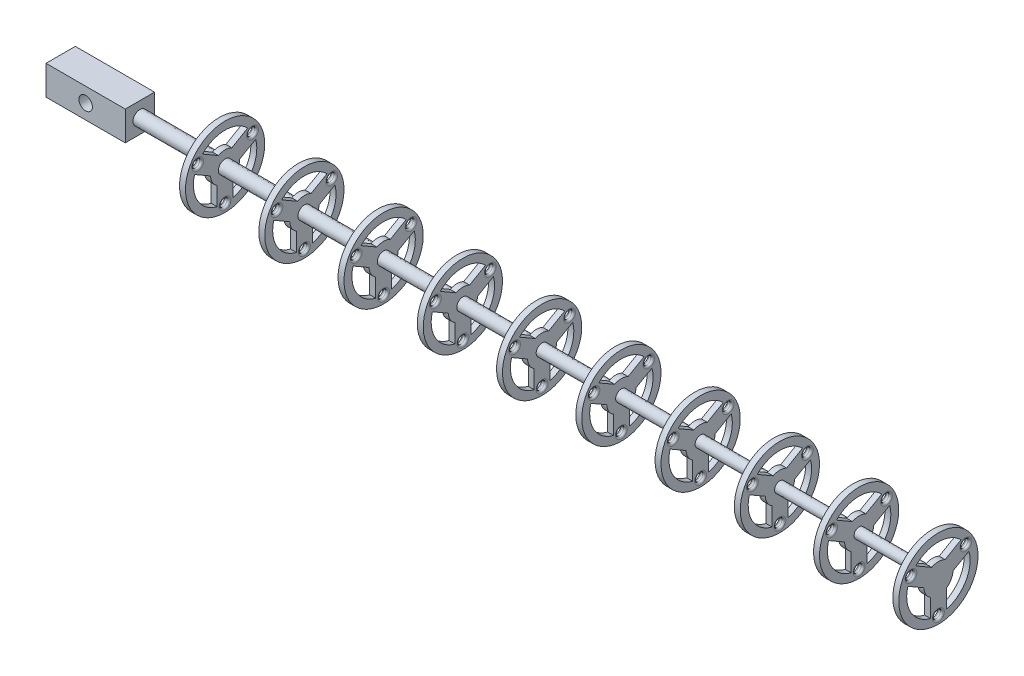
from build123d import *

# Parameters (mm, degrees)
SKETCH3_W                      = 1.5
SKETCH3_H                      = 10
CUT_EXTRUDE1_REACH             = 181.059
SKETCH5_R                      = 1
FILLET1_R                      = 0.5
LPATTERN1_COUNT                = 10
LPATTERN1_PITCH                = 20
FILLET1_OF_LPATTERN1_R         = 0.5
SKETCH16_W                     = 7.4
SKETCH16_H                     = 7.4
BOSS_EXTRUDE1_DEPTH            = 20
M3_CLEARANCE_HOLE1_D           = 3.4
M3_CLEARANCE_HOLE1_CSINK_D     = 3.45
M3_CLEARANCE_HOLE1_CSINK_ANGLE = 90


with BuildPart() as part:
    # Sketch2 → Revolve1 (revolve)
    with BuildSketch(Plane.XY):
        Polygon((0, 1.75), (200, 1.25), (200, 0), (0, 0), align=None)
    revolve(axis=Axis((200, 0, 0), (-1, 0, 0)))

    # Sketch3 → Revolve2 (revolve)
    with BuildSketch(Plane.XY):
        with Locations((20.75, 5)):
            Rectangle(SKETCH3_W, SKETCH3_H)
    revolve2 = revolve(axis=Axis((21.5, 0, 0), (-1, 0, 0)))

    # Sketch5 → Cut-Extrude1 (cut, up to next)
    with BuildSketch(Plane(origin=(21.5, 0, 0), x_dir=(0, 0, -1), z_dir=(1, 0, 0)), mode=Mode.PRIVATE) as cut_extrude1_sk1:
        with Locations((0, -8)):
            Circle(SKETCH5_R)
    cut_extrude1_tool1 = extrude(cut_extrude1_sk1.sketch, amount=-CUT_EXTRUDE1_REACH, mode=Mode.PRIVATE) & part.part
    # Sketch5 → Cut-Extrude1 (cut, up to next)
    with BuildSketch(Plane(origin=(21.5, 0, 0), x_dir=(0, 0, -1), z_dir=(1, 0, 0)), mode=Mode.PRIVATE) as cut_extrude1_sk2:
        with Locations((6.92820323, 4)):
            Circle(SKETCH5_R)
    cut_extrude1_tool2 = extrude(cut_extrude1_sk2.sketch, amount=-CUT_EXTRUDE1_REACH, mode=Mode.PRIVATE) & part.part
    # Sketch5 → Cut-Extrude1 (cut, up to next)
    with BuildSketch(Plane(origin=(21.5, 0, 0), x_dir=(0, 0, -1), z_dir=(1, 0, 0)), mode=Mode.PRIVATE) as cut_extrude1_sk3:
        with Locations((-6.92820323, 4)):
            Circle(SKETCH5_R)
    cut_extrude1_tool3 = extrude(cut_extrude1_sk3.sketch, amount=-CUT_EXTRUDE1_REACH, mode=Mode.PRIVATE) & part.part
    # Sketch5 → Cut-Extrude1 (cut, up to next)
    with BuildSketch(Plane(origin=(21.5, 0, 0), x_dir=(0, 0, -1), z_dir=(1, 0, 0)), mode=Mode.PRIVATE) as cut_extrude1_sk4:
        with BuildLine():
            Line((-5.708203932, 5.605034154), (-1.691969176, 3.286259936))
            ThreePointArc((-1.691969176, 3.286259936), (0, 3.69625), (1.691969176, 3.286259936))
            Line((1.691969176, 3.286259936), (5.708203932, 5.605034154))
            ThreePointArc((5.708203932, 5.605034154), (0, 8), (-5.708203932, 5.605034154))
        make_face()
    cut_extrude1_tool4 = extrude(cut_extrude1_sk4.sketch, amount=-CUT_EXTRUDE1_REACH, mode=Mode.PRIVATE) & part.part
    # Sketch5 → Cut-Extrude1 (cut, up to next)
    with BuildSketch(Plane(origin=(21.5, 0, 0), x_dir=(0, 0, -1), z_dir=(1, 0, 0)), mode=Mode.PRIVATE) as cut_extrude1_sk5:
        with BuildLine():
            Line((2, -3.108418257), (2, -7.745966692))
            ThreePointArc((2, -7.745966692), (6.92820323, -4), (7.708203932, 2.140932539))
            Line((7.708203932, 2.140932539), (3.691969176, -0.177841679))
            ThreePointArc((3.691969176, -0.177841679), (3.201046399, -1.848125), (2, -3.108418257))
        make_face()
    cut_extrude1_tool5 = extrude(cut_extrude1_sk5.sketch, amount=-CUT_EXTRUDE1_REACH, mode=Mode.PRIVATE) & part.part
    # Sketch5 → Cut-Extrude1 (cut, up to next)
    with BuildSketch(Plane(origin=(21.5, 0, 0), x_dir=(0, 0, -1), z_dir=(1, 0, 0)), mode=Mode.PRIVATE) as cut_extrude1_sk6:
        with BuildLine():
            Line((-3.691969176, -0.177841679), (-7.708203932, 2.140932539))
            ThreePointArc((-7.708203932, 2.140932539), (-6.92820323, -4), (-2, -7.745966692))
            Line((-2, -7.745966692), (-2, -3.108418257))
            ThreePointArc((-2, -3.108418257), (-3.201046399, -1.848125), (-3.691969176, -0.177841679))
        make_face()
    cut_extrude1_tool6 = extrude(cut_extrude1_sk6.sketch, amount=-CUT_EXTRUDE1_REACH, mode=Mode.PRIVATE) & part.part
    cut_extrude1_1 = cut_extrude1_tool1.solids().sort_by_distance((21.5, -8, 0))[0]
    add(cut_extrude1_1, mode=Mode.SUBTRACT)
    cut_extrude1_2 = cut_extrude1_tool2.solids().sort_by_distance((21.5, 4, -6.928203))[0]
    add(cut_extrude1_2, mode=Mode.SUBTRACT)
    cut_extrude1_3 = cut_extrude1_tool3.solids().sort_by_distance((21.5, 4, 6.928203))[0]
    add(cut_extrude1_3, mode=Mode.SUBTRACT)
    cut_extrude1_4 = cut_extrude1_tool4.solids().sort_by_distance((21.5, 5.720101, 0))[0]
    add(cut_extrude1_4, mode=Mode.SUBTRACT)
    cut_extrude1_5 = cut_extrude1_tool5.solids().sort_by_distance((21.5, -2.86005, -4.953753))[0]
    add(cut_extrude1_5, mode=Mode.SUBTRACT)
    cut_extrude1_6 = cut_extrude1_tool6.solids().sort_by_distance((21.5, -2.86005, 4.953753))[0]
    add(cut_extrude1_6, mode=Mode.SUBTRACT)
    cut_extrude1 = cut_extrude1_1 + cut_extrude1_2 + cut_extrude1_3 + cut_extrude1_4 + cut_extrude1_5 + cut_extrude1_6  # Cut-Extrude1 as one shape, for the pattern or mirror that repeats it

    # Fillet1
    fillet1_edges = [part.edges().sort_by_distance(p)[0] for p in [
        (20, 4, -5.92820323),
        (20, -8, 1),
        (21.5, -8, 1),
        (21.5, 4, -5.92820323),
        (20, 4, 7.92820323),
        (21.5, 4, 7.92820323),
    ]]
    fillet(fillet1_edges, radius=FILLET1_R)

    # LPattern1: Revolve2, Cut-Extrude1 ×10
    with Locations(*[(i * LPATTERN1_PITCH, 0, 0) for i in range(1, LPATTERN1_COUNT)]):
        add(revolve2)
        add(cut_extrude1, mode=Mode.SUBTRACT)

    # Fillet1 of LPattern1
    fillet1_of_lpattern1_edges = [part.edges().sort_by_distance(p)[0] for p in [
        (40, 4, -5.92820323),
        (40, -8, 1),
        (41.5, -8, 1),
        (41.5, 4, -5.92820323),
        (40, 4, 7.92820323),
        (41.5, 4, 7.92820323),
        (60, 4, -5.92820323),
        (60, -8, 1),
        (61.5, -8, 1),
        (61.5, 4, -5.92820323),
        (60, 4, 7.92820323),
        (61.5, 4, 7.92820323),
        (80, 4, -5.92820323),
        (80, -8, 1),
        (81.5, -8, 1),
        (81.5, 4, -5.92820323),
        (80, 4, 7.92820323),
        (81.5, 4, 7.92820323),
        (100, 4, -5.92820323),
        (100, -8, 1),
        (101.5, -8, 1),
        (101.5, 4, -5.92820323),
        (100, 4, 7.92820323),
        (101.5, 4, 7.92820323),
        (120, 4, -5.92820323),
        (120, -8, 1),
        (121.5, -8, 1),
        (121.5, 4, -5.92820323),
        (120, 4, 7.92820323),
        (121.5, 4, 7.92820323),
        (140, 4, -5.92820323),
        (140, -8, 1),
        (141.5, -8, 1),
        (141.5, 4, -5.92820323),
        (140, 4, 7.92820323),
        (141.5, 4, 7.92820323),
        (160, 4, -5.92820323),
        (160, -8, 1),
        (161.5, -8, 1),
        (161.5, 4, -5.92820323),
        (160, 4, 7.92820323),
        (161.5, 4, 7.92820323),
        (180, 4, -5.92820323),
        (180, -8, 1),
        (181.5, -8, 1),
        (181.5, 4, -5.92820323),
        (180, 4, 7.92820323),
        (181.5, 4, 7.92820323),
        (200, 4, -5.92820323),
        (200, -8, 1),
        (201.5, -8, 1),
        (201.5, 4, -5.92820323),
        (200, 4, 7.92820323),
        (201.5, 4, 7.92820323),
    ]]
    fillet(fillet1_of_lpattern1_edges, radius=FILLET1_OF_LPATTERN1_R)

    # Sketch16 → Boss-Extrude1 (add)
    with BuildSketch(Plane.ZY):
        Rectangle(SKETCH16_W, SKETCH16_H)
    extrude(amount=BOSS_EXTRUDE1_DEPTH)

    # M3 Clearance Hole1 (through all)
    with Locations(Plane(origin=(0, 0, -3.7), x_dir=(-1, 0, 0), z_dir=(0, 0, -1))):
        with Locations((10, 0)):
            CounterSinkHole(M3_CLEARANCE_HOLE1_D / 2, M3_CLEARANCE_HOLE1_CSINK_D / 2, counter_sink_angle=M3_CLEARANCE_HOLE1_CSINK_ANGLE)


solid = part.part
